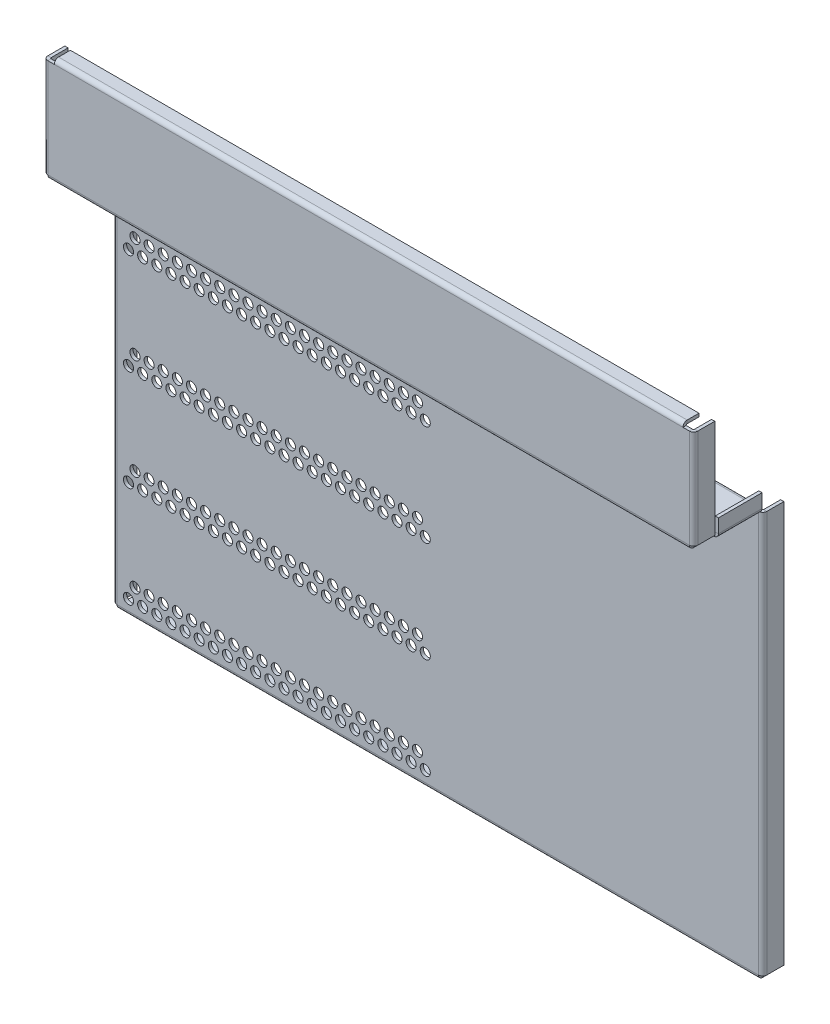
from build123d import *

# Parameters (mm, degrees)
SKETCH1_W                    = 634.26086
SKETCH1_H                    = 97.75444
BASE_FLANGE1_DEPTH           = 3.175
EDGE_FLANGE1_DEPTH           = 621.56086
EDGE_FLANGE2_DEPTH           = 97.75444
EDGE_FLANGE2_BEND_DEPTH      = 97.75444
EDGE_FLANGE3_DEPTH           = 634.26086
EDGE_FLANGE4_STRIP_W         = 14.7
EDGE_FLANGE4_STRIP_H         = 3.175
EDGE_FLANGE4_STRIP_CUT_DEPTH = 634.26086
EDGE_FLANGE4_DEPTH           = 634.26086
EDGE_FLANGE5_DEPTH           = 634.26086
EDGE_FLANGE6_DEPTH           = 397.01292
EDGE_FLANGE6_BEND_DEPTH      = 397.01292
EDGE_FLANGE7_DEPTH           = 43.19346
EDGE_FLANGE7_BEND_DEPTH      = 43.19346
CUT_EXTRUDE2_DEPTH           = 562.608451945
CUT_EXTRUDE2_DEPTH_BACK      = 562.608451945
SKETCH40_R                   = 5


# Sheet-metal steps are written as plain solids
with BuildPart() as part:
    # Sketch1 → Base-Flange1 (new body)
    with BuildSketch(Plane.XY):
        Rectangle(SKETCH1_W, SKETCH1_H)
    extrude(amount=-BASE_FLANGE1_DEPTH)

    # Edge-Flange1 section (across the edge) → Edge-Flange1 (add)
    with BuildSketch(Plane(origin=(-310.78043, 49.87722, -3.175), x_dir=(0, -1, 0), z_dir=(1, 0, 0))):
        with BuildLine():
            Line((-3.175, 1), (-3.175, 12.7))
            Line((-3.175, 12.7), (0, 12.7))
            Line((0, 12.7), (0, 1))
            ThreePointArc((0, 1), (0.292893219, 0.292893219), (1, 0))
            Line((1, 0), (1, -3.175))
            ThreePointArc((1, -3.175), (-1.952170811, -1.952170811), (-3.175, 1))
        make_face()
    extrude(amount=EDGE_FLANGE1_DEPTH)

    # Edge-Flange2 section (across the edge) → Edge-Flange2 (add)
    with BuildSketch(Plane(origin=(-318.13043, -48.87722, -3.175), x_dir=(1, 0, 0), z_dir=(0, 1, 0))):
        with BuildLine():
            Line((-3.175, 1), (-3.175, 17.78))
            Line((-3.175, 17.78), (0, 17.78))
            Line((0, 17.78), (0, 1))
            ThreePointArc((0, 1), (0.292893219, 0.292893219), (1, 0))
            Line((1, 0), (1, -3.175))
            ThreePointArc((1, -3.175), (-1.952170811, -1.952170811), (-3.175, 1))
        make_face()
    extrude(amount=EDGE_FLANGE2_DEPTH)

    # Edge-Flange2 section 2 (across the edge) → Edge-Flange2 bend (add)
    with BuildSketch(Plane(origin=(318.13043, 48.87722, -3.175), x_dir=(-1, 0, 0), z_dir=(0, -1, 0))):
        with BuildLine():
            Line((-3.175, 1), (-3.175, 17.78))
            Line((-3.175, 17.78), (0, 17.78))
            Line((0, 17.78), (0, 1))
            ThreePointArc((0, 1), (0.292893219, 0.292893219), (1, 0))
            Line((1, 0), (1, -3.175))
            ThreePointArc((1, -3.175), (-1.952170811, -1.952170811), (-3.175, 1))
        make_face()
    extrude(amount=EDGE_FLANGE2_BEND_DEPTH)

    # Edge-Flange3 section (across the edge) → Edge-Flange3 (add)
    with BuildSketch(Plane(origin=(317.13043, -49.87722, -3.175), x_dir=(0, 1, 0), z_dir=(-1, 0, 0))):
        with BuildLine():
            Line((-3.175, 1), (-3.175, 68.32346))
            Line((-3.175, 68.32346), (0, 68.32346))
            Line((0, 68.32346), (0, 1))
            ThreePointArc((0, 1), (0.292893219, 0.292893219), (1, 0))
            Line((1, 0), (1, -3.175))
            ThreePointArc((1, -3.175), (-1.952170811, -1.952170811), (-3.175, 1))
        make_face()
    extrude(amount=EDGE_FLANGE3_DEPTH)

    # Edge-Flange4 strip (across the edge) → Edge-Flange4 strip cut (cut)
    with BuildSketch(Plane(origin=(-317.13043, -53.05222, -71.49846), x_dir=(0, 0, 1), z_dir=(1, 0, 0))):
        with Locations((-3.175, -1.5875)):
            Rectangle(EDGE_FLANGE4_STRIP_W, EDGE_FLANGE4_STRIP_H)
    extrude(amount=EDGE_FLANGE4_STRIP_CUT_DEPTH, mode=Mode.SUBTRACT)

    # Edge-Flange4 section (across the edge) → Edge-Flange4 (add)
    with BuildSketch(Plane(origin=(-317.13043, -53.05222, -71.49846), x_dir=(0, 0, 1), z_dir=(1, 0, 0))):
        with BuildLine():
            Line((0, 1), (0, 398.01292))
            Line((0, 398.01292), (3.175, 398.01292))
            Line((3.175, 398.01292), (3.175, 1))
            ThreePointArc((3.175, 1), (3.467893219, 0.292893219), (4.175, 0))
            Line((4.175, 0), (4.175, -3.175))
            ThreePointArc((4.175, -3.175), (1.222829189, -1.952170811), (0, 1))
        make_face()
    extrude(amount=EDGE_FLANGE4_DEPTH)

    # Edge-Flange5 section (across the edge) → Edge-Flange5 (add)
    with BuildSketch(Plane(origin=(317.13043, -452.06514, -71.49846), x_dir=(0, 1, 0), z_dir=(-1, 0, 0))):
        with BuildLine():
            Line((-3.175, 1), (-3.175, 17.78))
            Line((-3.175, 17.78), (0, 17.78))
            Line((0, 17.78), (0, 1))
            ThreePointArc((0, 1), (0.292893219, 0.292893219), (1, 0))
            Line((1, 0), (1, -3.175))
            ThreePointArc((1, -3.175), (-1.952170811, -1.952170811), (-3.175, 1))
        make_face()
    extrude(amount=EDGE_FLANGE5_DEPTH)

    # Edge-Flange6 section (across the edge) → Edge-Flange6 (add)
    with BuildSketch(Plane(origin=(-318.13043, -451.06514, -71.49846), x_dir=(1, 0, 0), z_dir=(0, 1, 0))):
        with BuildLine():
            Line((-3.175, 1), (-3.175, 17.78))
            Line((-3.175, 17.78), (0, 17.78))
            Line((0, 17.78), (0, 1))
            ThreePointArc((0, 1), (0.292893219, 0.292893219), (1, 0))
            Line((1, 0), (1, -3.175))
            ThreePointArc((1, -3.175), (-1.952170811, -1.952170811), (-3.175, 1))
        make_face()
    extrude(amount=EDGE_FLANGE6_DEPTH)

    # Edge-Flange6 section 2 (across the edge) → Edge-Flange6 bend (add)
    with BuildSketch(Plane(origin=(318.13043, -54.05222, -71.49846), x_dir=(-1, 0, 0), z_dir=(0, -1, 0))):
        with BuildLine():
            Line((-3.175, 1), (-3.175, 17.78))
            Line((-3.175, 17.78), (0, 17.78))
            Line((0, 17.78), (0, 1))
            ThreePointArc((0, 1), (0.292893219, 0.292893219), (1, 0))
            Line((1, 0), (1, -3.175))
            ThreePointArc((1, -3.175), (-1.952170811, -1.952170811), (-3.175, 1))
        make_face()
    extrude(amount=EDGE_FLANGE6_BEND_DEPTH)

    # Edge-Flange7 section (across the edge) → Edge-Flange7 (add)
    with BuildSketch(Plane(origin=(318.527305, -49.87722, -24.13), x_dir=(-1, 0, 0), z_dir=(0, 0, -1))):
        with BuildLine():
            Line((-3.175, 1), (-3.175, 14.605))
            Line((-3.175, 14.605), (0, 14.605))
            Line((0, 14.605), (0, 1))
            ThreePointArc((0, 1), (0.292893219, 0.292893219), (1, 0))
            Line((1, 0), (1.396875, 0))
            Line((1.396875, 0), (1.396875, -3.175))
            Line((1.396875, -3.175), (1, -3.175))
            ThreePointArc((1, -3.175), (-1.952170811, -1.952170811), (-3.175, 1))
        make_face()
    extrude(amount=EDGE_FLANGE7_DEPTH)

    # Edge-Flange7 section 2 (across the edge) → Edge-Flange7 bend (add)
    with BuildSketch(Plane(origin=(-318.527305, -49.87722, -67.32346), x_dir=(1, 0, 0), z_dir=(0, 0, 1))):
        with BuildLine():
            Line((-3.175, 1), (-3.175, 14.605))
            Line((-3.175, 14.605), (0, 14.605))
            Line((0, 14.605), (0, 1))
            ThreePointArc((0, 1), (0.292893219, 0.292893219), (1, 0))
            Line((1, 0), (1.396875, 0))
            Line((1.396875, 0), (1.396875, -3.175))
            Line((1.396875, -3.175), (1, -3.175))
            ThreePointArc((1, -3.175), (-1.952170811, -1.952170811), (-3.175, 1))
        make_face()
    extrude(amount=EDGE_FLANGE7_BEND_DEPTH)

    # Sketch40 → Cut-Extrude2 (cut, two sides: drawn at the far end of the back side and taken through both)
    with BuildSketch(Plane.XY.offset(-68.32346).offset(-CUT_EXTRUDE2_DEPTH_BACK)):
        with Locations(Location((-305.70043, -141.09802, 0), (0, 0, 270))):
            Circle(SKETCH40_R)
        with Locations(Location((-291.73043, -141.09802, 0), (0, 0, 270))):
            Circle(SKETCH40_R)
        with Locations(Location((-277.76043, -141.09802, 0), (0, 0, 270))):
            Circle(SKETCH40_R)
        with Locations(Location((-263.79043, -141.09802, 0), (0, 0, 270))):
            Circle(SKETCH40_R)
        with Locations(Location((-249.82043, -141.09802, 0), (0, 0, 270))):
            Circle(SKETCH40_R)
        with Locations(Location((-235.85043, -141.09802, 0), (0, 0, 270))):
            Circle(SKETCH40_R)
        with Locations(Location((-221.88043, -141.09802, 0), (0, 0, 270))):
            Circle(SKETCH40_R)
        with Locations(Location((-207.91043, -141.09802, 0), (0, 0, 270))):
            Circle(SKETCH40_R)
        with Locations(Location((-193.94043, -141.09802, 0), (0, 0, 270))):
            Circle(SKETCH40_R)
        with Locations(Location((-179.97043, -141.09802, 0), (0, 0, 270))):
            Circle(SKETCH40_R)
        with Locations(Location((-166.00043, -141.09802, 0), (0, 0, 270))):
            Circle(SKETCH40_R)
        with Locations(Location((-152.03043, -141.09802, 0), (0, 0, 270))):
            Circle(SKETCH40_R)
        with Locations(Location((-138.06043, -141.09802, 0), (0, 0, 270))):
            Circle(SKETCH40_R)
        with Locations(Location((-124.09043, -141.09802, 0), (0, 0, 270))):
            Circle(SKETCH40_R)
        with Locations(Location((-110.12043, -141.09802, 0), (0, 0, 270))):
            Circle(SKETCH40_R)
        with Locations(Location((-96.15043, -141.09802, 0), (0, 0, 270))):
            Circle(SKETCH40_R)
        with Locations(Location((-82.18043, -141.09802, 0), (0, 0, 270))):
            Circle(SKETCH40_R)
        with Locations(Location((-68.21043, -141.09802, 0), (0, 0, 270))):
            Circle(SKETCH40_R)
        with Locations(Location((-54.24043, -141.09802, 0), (0, 0, 270))):
            Circle(SKETCH40_R)
        with Locations(Location((-40.27043, -141.09802, 0), (0, 0, 270))):
            Circle(SKETCH40_R)
        with Locations(Location((-26.30043, -141.09802, 0), (0, 0, 270))):
            Circle(SKETCH40_R)
        with Locations(Location((-12.33043, -141.09802, 0), (0, 0, 270))):
            Circle(SKETCH40_R)
        with Locations(Location((-305.70043, -240.84382, 0), (0, 0, 270))):
            Circle(SKETCH40_R)
        with Locations(Location((-291.73043, -240.84382, 0), (0, 0, 270))):
            Circle(SKETCH40_R)
        with Locations(Location((-277.76043, -240.84382, 0), (0, 0, 270))):
            Circle(SKETCH40_R)
        with Locations(Location((-263.79043, -240.84382, 0), (0, 0, 270))):
            Circle(SKETCH40_R)
        with Locations(Location((-249.82043, -240.84382, 0), (0, 0, 270))):
            Circle(SKETCH40_R)
        with Locations(Location((-235.85043, -240.84382, 0), (0, 0, 270))):
            Circle(SKETCH40_R)
        with Locations(Location((-221.88043, -240.84382, 0), (0, 0, 270))):
            Circle(SKETCH40_R)
        with Locations(Location((-207.91043, -240.84382, 0), (0, 0, 270))):
            Circle(SKETCH40_R)
        with Locations(Location((-193.94043, -240.84382, 0), (0, 0, 270))):
            Circle(SKETCH40_R)
        with Locations(Location((-179.97043, -240.84382, 0), (0, 0, 270))):
            Circle(SKETCH40_R)
        with Locations(Location((-166.00043, -240.84382, 0), (0, 0, 270))):
            Circle(SKETCH40_R)
        with Locations(Location((-152.03043, -240.84382, 0), (0, 0, 270))):
            Circle(SKETCH40_R)
        with Locations(Location((-138.06043, -240.84382, 0), (0, 0, 270))):
            Circle(SKETCH40_R)
        with Locations(Location((-12.33043, -240.84382, 0), (0, 0, 270))):
            Circle(SKETCH40_R)
        with Locations(Location((-26.30043, -240.84382, 0), (0, 0, 270))):
            Circle(SKETCH40_R)
        with Locations(Location((-40.27043, -240.84382, 0), (0, 0, 270))):
            Circle(SKETCH40_R)
        with Locations(Location((-54.24043, -240.84382, 0), (0, 0, 270))):
            Circle(SKETCH40_R)
        with Locations(Location((-68.21043, -240.84382, 0), (0, 0, 270))):
            Circle(SKETCH40_R)
        with Locations(Location((-82.18043, -240.84382, 0), (0, 0, 270))):
            Circle(SKETCH40_R)
        with Locations(Location((-96.15043, -240.84382, 0), (0, 0, 270))):
            Circle(SKETCH40_R)
        with Locations(Location((-110.12043, -240.84382, 0), (0, 0, 270))):
            Circle(SKETCH40_R)
        with Locations(Location((-124.09043, -240.84382, 0), (0, 0, 270))):
            Circle(SKETCH40_R)
        with Locations(Location((-305.70043, -340.58962, 0), (0, 0, 270))):
            Circle(SKETCH40_R)
        with Locations(Location((-291.73043, -340.58962, 0), (0, 0, 270))):
            Circle(SKETCH40_R)
        with Locations(Location((-277.76043, -340.58962, 0), (0, 0, 270))):
            Circle(SKETCH40_R)
        with Locations(Location((-263.79043, -340.58962, 0), (0, 0, 270))):
            Circle(SKETCH40_R)
        with Locations(Location((-249.82043, -340.58962, 0), (0, 0, 270))):
            Circle(SKETCH40_R)
        with Locations(Location((-235.85043, -340.58962, 0), (0, 0, 270))):
            Circle(SKETCH40_R)
        with Locations(Location((-221.88043, -340.58962, 0), (0, 0, 270))):
            Circle(SKETCH40_R)
        with Locations(Location((-207.91043, -340.58962, 0), (0, 0, 270))):
            Circle(SKETCH40_R)
        with Locations(Location((-193.94043, -340.58962, 0), (0, 0, 270))):
            Circle(SKETCH40_R)
        with Locations(Location((-179.97043, -340.58962, 0), (0, 0, 270))):
            Circle(SKETCH40_R)
        with Locations(Location((-166.00043, -340.58962, 0), (0, 0, 270))):
            Circle(SKETCH40_R)
        with Locations(Location((-152.03043, -340.58962, 0), (0, 0, 270))):
            Circle(SKETCH40_R)
        with Locations(Location((-138.06043, -340.58962, 0), (0, 0, 270))):
            Circle(SKETCH40_R)
        with Locations(Location((-12.33043, -340.58962, 0), (0, 0, 270))):
            Circle(SKETCH40_R)
        with Locations(Location((-26.30043, -340.58962, 0), (0, 0, 270))):
            Circle(SKETCH40_R)
        with Locations(Location((-40.27043, -340.58962, 0), (0, 0, 270))):
            Circle(SKETCH40_R)
        with Locations(Location((-54.24043, -340.58962, 0), (0, 0, 270))):
            Circle(SKETCH40_R)
        with Locations(Location((-68.21043, -340.58962, 0), (0, 0, 270))):
            Circle(SKETCH40_R)
        with Locations(Location((-82.18043, -340.58962, 0), (0, 0, 270))):
            Circle(SKETCH40_R)
        with Locations(Location((-96.15043, -340.58962, 0), (0, 0, 270))):
            Circle(SKETCH40_R)
        with Locations(Location((-110.12043, -340.58962, 0), (0, 0, 270))):
            Circle(SKETCH40_R)
        with Locations(Location((-124.09043, -340.58962, 0), (0, 0, 270))):
            Circle(SKETCH40_R)
        with Locations(Location((-305.70043, -440.33542, 0), (0, 0, 270))):
            Circle(SKETCH40_R)
        with Locations(Location((-291.73043, -440.33542, 0), (0, 0, 270))):
            Circle(SKETCH40_R)
        with Locations(Location((-277.76043, -440.33542, 0), (0, 0, 270))):
            Circle(SKETCH40_R)
        with Locations(Location((-263.79043, -440.33542, 0), (0, 0, 270))):
            Circle(SKETCH40_R)
        with Locations(Location((-249.82043, -440.33542, 0), (0, 0, 270))):
            Circle(SKETCH40_R)
        with Locations(Location((-235.85043, -440.33542, 0), (0, 0, 270))):
            Circle(SKETCH40_R)
        with Locations(Location((-221.88043, -440.33542, 0), (0, 0, 270))):
            Circle(SKETCH40_R)
        with Locations(Location((-207.91043, -440.33542, 0), (0, 0, 270))):
            Circle(SKETCH40_R)
        with Locations(Location((-193.94043, -440.33542, 0), (0, 0, 270))):
            Circle(SKETCH40_R)
        with Locations(Location((-179.97043, -440.33542, 0), (0, 0, 270))):
            Circle(SKETCH40_R)
        with Locations(Location((-166.00043, -440.33542, 0), (0, 0, 270))):
            Circle(SKETCH40_R)
        with Locations(Location((-152.03043, -440.33542, 0), (0, 0, 270))):
            Circle(SKETCH40_R)
        with Locations(Location((-138.06043, -440.33542, 0), (0, 0, 270))):
            Circle(SKETCH40_R)
        with Locations(Location((-12.33043, -440.33542, 0), (0, 0, 270))):
            Circle(SKETCH40_R)
        with Locations(Location((-26.30043, -440.33542, 0), (0, 0, 270))):
            Circle(SKETCH40_R)
        with Locations(Location((-40.27043, -440.33542, 0), (0, 0, 270))):
            Circle(SKETCH40_R)
        with Locations(Location((-54.24043, -440.33542, 0), (0, 0, 270))):
            Circle(SKETCH40_R)
        with Locations(Location((-68.21043, -440.33542, 0), (0, 0, 270))):
            Circle(SKETCH40_R)
        with Locations(Location((-82.18043, -440.33542, 0), (0, 0, 270))):
            Circle(SKETCH40_R)
        with Locations(Location((-96.15043, -440.33542, 0), (0, 0, 270))):
            Circle(SKETCH40_R)
        with Locations(Location((-110.12043, -440.33542, 0), (0, 0, 270))):
            Circle(SKETCH40_R)
        with Locations(Location((-124.09043, -440.33542, 0), (0, 0, 270))):
            Circle(SKETCH40_R)
        with Locations(Location((-299.35043, -128.39802, 0), (0, 0, 270))):
            Circle(SKETCH40_R)
        with Locations(Location((-285.38043, -128.39802, 0), (0, 0, 270))):
            Circle(SKETCH40_R)
        with Locations(Location((-271.41043, -128.39802, 0), (0, 0, 270))):
            Circle(SKETCH40_R)
        with Locations(Location((-257.44043, -128.39802, 0), (0, 0, 270))):
            Circle(SKETCH40_R)
        with Locations(Location((-243.47043, -128.39802, 0), (0, 0, 270))):
            Circle(SKETCH40_R)
        with Locations(Location((-229.50043, -128.39802, 0), (0, 0, 270))):
            Circle(SKETCH40_R)
        with Locations(Location((-215.53043, -128.39802, 0), (0, 0, 270))):
            Circle(SKETCH40_R)
        with Locations(Location((-201.56043, -128.39802, 0), (0, 0, 270))):
            Circle(SKETCH40_R)
        with Locations(Location((-187.59043, -128.39802, 0), (0, 0, 270))):
            Circle(SKETCH40_R)
        with Locations(Location((-173.62043, -128.39802, 0), (0, 0, 270))):
            Circle(SKETCH40_R)
        with Locations(Location((-159.65043, -128.39802, 0), (0, 0, 270))):
            Circle(SKETCH40_R)
        with Locations(Location((-145.68043, -128.39802, 0), (0, 0, 270))):
            Circle(SKETCH40_R)
        with Locations(Location((-131.71043, -128.39802, 0), (0, 0, 270))):
            Circle(SKETCH40_R)
        with Locations(Location((-117.74043, -128.39802, 0), (0, 0, 270))):
            Circle(SKETCH40_R)
        with Locations(Location((-103.77043, -128.39802, 0), (0, 0, 270))):
            Circle(SKETCH40_R)
        with Locations(Location((-89.80043, -128.39802, 0), (0, 0, 270))):
            Circle(SKETCH40_R)
        with Locations(Location((-75.83043, -128.39802, 0), (0, 0, 270))):
            Circle(SKETCH40_R)
        with Locations(Location((-61.86043, -128.39802, 0), (0, 0, 270))):
            Circle(SKETCH40_R)
        with Locations(Location((-47.89043, -128.39802, 0), (0, 0, 270))):
            Circle(SKETCH40_R)
        with Locations(Location((-33.92043, -128.39802, 0), (0, 0, 270))):
            Circle(SKETCH40_R)
        with Locations(Location((-19.95043, -128.39802, 0), (0, 0, 270))):
            Circle(SKETCH40_R)
        with Locations(Location((-299.35043, -228.14382, 0), (0, 0, 270))):
            Circle(SKETCH40_R)
        with Locations(Location((-285.38043, -228.14382, 0), (0, 0, 270))):
            Circle(SKETCH40_R)
        with Locations(Location((-271.41043, -228.14382, 0), (0, 0, 270))):
            Circle(SKETCH40_R)
        with Locations(Location((-257.44043, -228.14382, 0), (0, 0, 270))):
            Circle(SKETCH40_R)
        with Locations(Location((-243.47043, -228.14382, 0), (0, 0, 270))):
            Circle(SKETCH40_R)
        with Locations(Location((-229.50043, -228.14382, 0), (0, 0, 270))):
            Circle(SKETCH40_R)
        with Locations(Location((-215.53043, -228.14382, 0), (0, 0, 270))):
            Circle(SKETCH40_R)
        with Locations(Location((-201.56043, -228.14382, 0), (0, 0, 270))):
            Circle(SKETCH40_R)
        with Locations(Location((-187.59043, -228.14382, 0), (0, 0, 270))):
            Circle(SKETCH40_R)
        with Locations(Location((-173.62043, -228.14382, 0), (0, 0, 270))):
            Circle(SKETCH40_R)
        with Locations(Location((-159.65043, -228.14382, 0), (0, 0, 270))):
            Circle(SKETCH40_R)
        with Locations(Location((-145.68043, -228.14382, 0), (0, 0, 270))):
            Circle(SKETCH40_R)
        with Locations(Location((-131.71043, -228.14382, 0), (0, 0, 270))):
            Circle(SKETCH40_R)
        with Locations(Location((-117.74043, -228.14382, 0), (0, 0, 270))):
            Circle(SKETCH40_R)
        with Locations(Location((-103.77043, -228.14382, 0), (0, 0, 270))):
            Circle(SKETCH40_R)
        with Locations(Location((-89.80043, -228.14382, 0), (0, 0, 270))):
            Circle(SKETCH40_R)
        with Locations(Location((-75.83043, -228.14382, 0), (0, 0, 270))):
            Circle(SKETCH40_R)
        with Locations(Location((-61.86043, -228.14382, 0), (0, 0, 270))):
            Circle(SKETCH40_R)
        with Locations(Location((-47.89043, -228.14382, 0), (0, 0, 270))):
            Circle(SKETCH40_R)
        with Locations(Location((-33.92043, -228.14382, 0), (0, 0, 270))):
            Circle(SKETCH40_R)
        with Locations(Location((-19.95043, -228.14382, 0), (0, 0, 270))):
            Circle(SKETCH40_R)
        with Locations(Location((-299.35043, -327.88962, 0), (0, 0, 270))):
            Circle(SKETCH40_R)
        with Locations(Location((-285.38043, -327.88962, 0), (0, 0, 270))):
            Circle(SKETCH40_R)
        with Locations(Location((-271.41043, -327.88962, 0), (0, 0, 270))):
            Circle(SKETCH40_R)
        with Locations(Location((-257.44043, -327.88962, 0), (0, 0, 270))):
            Circle(SKETCH40_R)
        with Locations(Location((-243.47043, -327.88962, 0), (0, 0, 270))):
            Circle(SKETCH40_R)
        with Locations(Location((-229.50043, -327.88962, 0), (0, 0, 270))):
            Circle(SKETCH40_R)
        with Locations(Location((-215.53043, -327.88962, 0), (0, 0, 270))):
            Circle(SKETCH40_R)
        with Locations(Location((-201.56043, -327.88962, 0), (0, 0, 270))):
            Circle(SKETCH40_R)
        with Locations(Location((-187.59043, -327.88962, 0), (0, 0, 270))):
            Circle(SKETCH40_R)
        with Locations(Location((-173.62043, -327.88962, 0), (0, 0, 270))):
            Circle(SKETCH40_R)
        with Locations(Location((-159.65043, -327.88962, 0), (0, 0, 270))):
            Circle(SKETCH40_R)
        with Locations(Location((-145.68043, -327.88962, 0), (0, 0, 270))):
            Circle(SKETCH40_R)
        with Locations(Location((-131.71043, -327.88962, 0), (0, 0, 270))):
            Circle(SKETCH40_R)
        with Locations(Location((-117.74043, -327.88962, 0), (0, 0, 270))):
            Circle(SKETCH40_R)
        with Locations(Location((-103.77043, -327.88962, 0), (0, 0, 270))):
            Circle(SKETCH40_R)
        with Locations(Location((-89.80043, -327.88962, 0), (0, 0, 270))):
            Circle(SKETCH40_R)
        with Locations(Location((-75.83043, -327.88962, 0), (0, 0, 270))):
            Circle(SKETCH40_R)
        with Locations(Location((-61.86043, -327.88962, 0), (0, 0, 270))):
            Circle(SKETCH40_R)
        with Locations(Location((-47.89043, -327.88962, 0), (0, 0, 270))):
            Circle(SKETCH40_R)
        with Locations(Location((-33.92043, -327.88962, 0), (0, 0, 270))):
            Circle(SKETCH40_R)
        with Locations(Location((-19.95043, -327.88962, 0), (0, 0, 270))):
            Circle(SKETCH40_R)
        with Locations(Location((-299.35043, -427.63542, 0), (0, 0, 270))):
            Circle(SKETCH40_R)
        with Locations(Location((-285.38043, -427.63542, 0), (0, 0, 270))):
            Circle(SKETCH40_R)
        with Locations(Location((-271.41043, -427.63542, 0), (0, 0, 270))):
            Circle(SKETCH40_R)
        with Locations(Location((-257.44043, -427.63542, 0), (0, 0, 270))):
            Circle(SKETCH40_R)
        with Locations(Location((-243.47043, -427.63542, 0), (0, 0, 270))):
            Circle(SKETCH40_R)
        with Locations(Location((-229.50043, -427.63542, 0), (0, 0, 270))):
            Circle(SKETCH40_R)
        with Locations(Location((-215.53043, -427.63542, 0), (0, 0, 270))):
            Circle(SKETCH40_R)
        with Locations(Location((-201.56043, -427.63542, 0), (0, 0, 270))):
            Circle(SKETCH40_R)
        with Locations(Location((-187.59043, -427.63542, 0), (0, 0, 270))):
            Circle(SKETCH40_R)
        with Locations(Location((-173.62043, -427.63542, 0), (0, 0, 270))):
            Circle(SKETCH40_R)
        with Locations(Location((-159.65043, -427.63542, 0), (0, 0, 270))):
            Circle(SKETCH40_R)
        with Locations(Location((-145.68043, -427.63542, 0), (0, 0, 270))):
            Circle(SKETCH40_R)
        with Locations(Location((-131.71043, -427.63542, 0), (0, 0, 270))):
            Circle(SKETCH40_R)
        with Locations(Location((-117.74043, -427.63542, 0), (0, 0, 270))):
            Circle(SKETCH40_R)
        with Locations(Location((-103.77043, -427.63542, 0), (0, 0, 270))):
            Circle(SKETCH40_R)
        with Locations(Location((-89.80043, -427.63542, 0), (0, 0, 270))):
            Circle(SKETCH40_R)
        with Locations(Location((-75.83043, -427.63542, 0), (0, 0, 270))):
            Circle(SKETCH40_R)
        with Locations(Location((-61.86043, -427.63542, 0), (0, 0, 270))):
            Circle(SKETCH40_R)
        with Locations(Location((-47.89043, -427.63542, 0), (0, 0, 270))):
            Circle(SKETCH40_R)
        with Locations(Location((-33.92043, -427.63542, 0), (0, 0, 270))):
            Circle(SKETCH40_R)
        with Locations(Location((-19.95043, -427.63542, 0), (0, 0, 270))):
            Circle(SKETCH40_R)
    extrude(amount=CUT_EXTRUDE2_DEPTH + CUT_EXTRUDE2_DEPTH_BACK, mode=Mode.SUBTRACT)


solid = part.part
